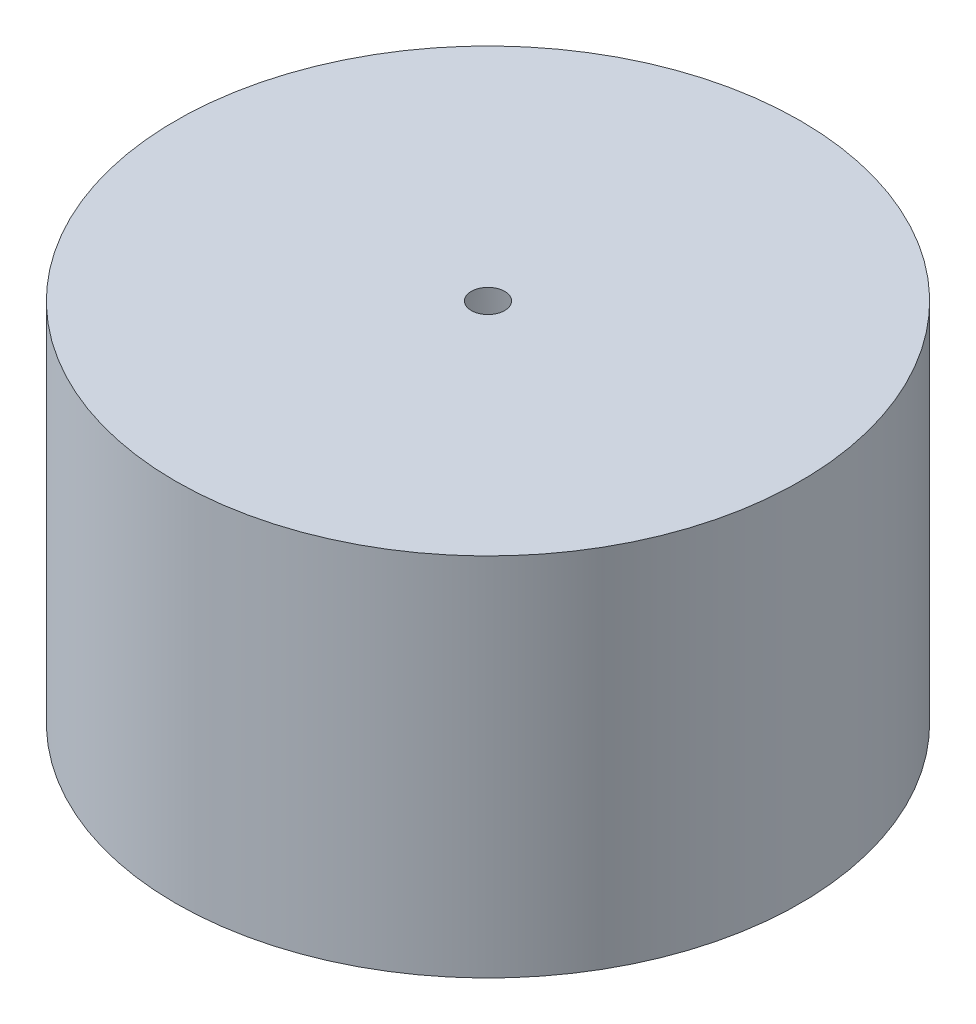
from build123d import *


with BuildPart() as part:
    # Эскиз1 → Повернуть1 (revolve)
    with BuildSketch(Plane.XY):
        with BuildLine():
            Line((30, 28.7946265), (30, 26.2946265))
            Line((30, 26.2946265), (28.4, 26.2946265))
            Line((28.4, 26.2946265), (28.4, 18.2946265))
            Line((28.4, 18.2946265), (37.427682956, 18.2946265))
            Line((37.427682956, 18.2946265), (37.427682956, 62.097891733))
            Line((37.427682956, 62.097891733), (2, 62.097891733))
            Line((2, 62.097891733), (8, 58.633790118))
            Line((8, 58.633790118), (8.347561618, 52.001919373))
            Line((8.347561618, 52.001919373), (10.747561618, 49.401919373))
            Line((10.747561618, 49.401919373), (10.957125062, 43.400807519))
            ThreePointArc((10.957125062, 43.400807519), (12.735833252, 42.470991023), (11.997561618, 40.6046265))
            Line((11.997561618, 40.6046265), (12.228387905, 33.9946265))
            Line((12.228387905, 33.9946265), (16.228387905, 29.9946265))
            Line((16.228387905, 29.9946265), (30, 29.9946265))
            Line((30, 29.9946265), (30, 28.7946265))
        make_face()
    revolve(axis=Axis((0, 0, 0), (0, 1, 0)))


solid = part.part
